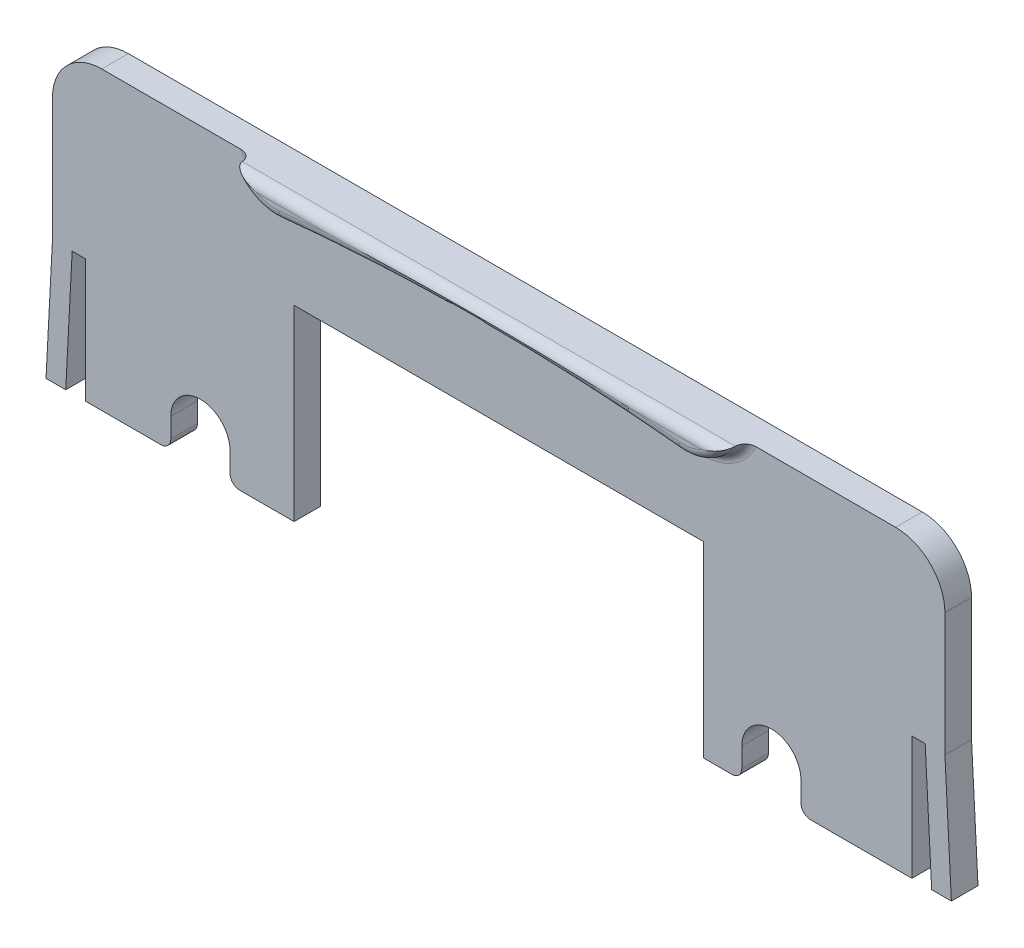
from build123d import *

# Parameters (mm, degrees)
BOSS_EXTRUDE1_DEPTH  = 2.7
FILLET1_R            = 5
BOSS_EXTRUDE2_DEPTH  = 2
FILLET2_R            = 5
FILLET3_R            = 1
FASTENER_HOLES_DEPTH = 52.527686738
FILLET4_R            = 1
WEDGE_DEPTH          = 2.7
CUT_EXTRUDE2_DEPTH   = 53.103914951


with BuildPart() as part:
    # Sketch1 → Boss-Extrude1 (new body)
    with BuildSketch(Plane.XY):
        Polygon((-20.75, -5.5), (20.75, -5.5), (20.75, -24.5), (45.25, -24.5), (45.25, -5.5), (45.25, 5.5), (-45.25, 5.5), (-45.25, -5.5), (-45.25, -24.5), (-20.75, -24.5), align=None)
    extrude(amount=-BOSS_EXTRUDE1_DEPTH)

    # Fillet1
    fillet1_edges = [part.edges().sort_by_distance(p)[0] for p in [
        (-45.25, 5.5, -1.35),
        (45.25, 5.5, -1.35),
    ]]
    fillet(fillet1_edges, radius=FILLET1_R)

    # Sketch2 → Boss-Extrude2 (add)
    with BuildSketch(Plane.XY):
        with BuildLine():
            Line((-25, 5.5), (25, 5.5))
            Line((25, 5.5), (25, 2.5))
            ThreePointArc((25, 2.5), (0, 4.06865167), (-25, 2.5))
            Line((-25, 2.5), (-25, 5.5))
        make_face()
    extrude(amount=BOSS_EXTRUDE2_DEPTH)

    # Fillet2
    # the kernel refuses this fillet: 5 mm, written as the material it takes off along each edge
    with BuildSketch(Plane(origin=(-25, 2.5, 0), x_dir=(0, 1, 0), z_dir=(0, 0, 1))) as fillet2_piece_1:
        with BuildLine():
            CenterArc((5.522601094, -4.316999388), FILLET2_R, 120.299508601, 65.491069006)
            ThreePointArc((0.548114523, -4.821462818), (0.288680447, -2.409069013), (0, 0))
            Line((0, 0), (3, 0))
        make_face()
    extrude(amount=14.131295591, mode=Mode.SUBTRACT)
    with BuildSketch(Plane(origin=(25, 2.5, 0), x_dir=(-0.9936001438850942, 0.11295465493515582, 0), z_dir=(0, 0, 1))) as fillet2_piece_2:
        with BuildLine():
            CenterArc((4.913174714, -4.999632066), FILLET2_R, 90.695089087, 65.491069006)
            Line((0.338863965, -2.980800432), (0, 0))
            ThreePointArc((0, 0), (2.426259118, -0.014717375), (4.852518236, 0))
        make_face()
    extrude(amount=14.131295591, mode=Mode.SUBTRACT)

    # Fillet3
    # the kernel refuses this fillet: 1 mm, written as the material it adds along each edge
    with BuildSketch(Plane(origin=(20.683000612, 8.022601094, 0), x_dir=(-0.10089268591027718, -0.9948973142640452, 0), z_dir=(-0.9948973142640452, 0.10089268591027718, 0))) as fillet3_piece_1_section:
        with BuildLine():
            CenterArc((5 + FILLET3_R, FILLET3_R), FILLET3_R, 180, 90)
            Line((5, FILLET3_R), (5, 0))
            Line((5, 0), (5 + FILLET3_R, 0))
        make_face()
    fillet3_piece_1 = revolve(axis=Axis((20.683000612, 8.022601094, 0), (0, 0, 1)), revolution_arc=94.145051676, mode=Mode.PRIVATE)
    fillet3_piece_1 = split(fillet3_piece_1, bisect_by=Plane(origin=(23.299245225, 5.5, 0.284698162), z_dir=(0, -1, 0)), keep=Keep.TOP, mode=Mode.PRIVATE)
    add(fillet3_piece_1)
    with BuildSketch(Plane(origin=(0, -195.93134833, 0), x_dir=(0.1008926859104223, 0.9948973142640303, 0), z_dir=(0.9948973142640303, -0.1008926859104223, 0))) as fillet3_piece_2:
        with BuildLine():
            CenterArc((200 - FILLET3_R, FILLET3_R), FILLET3_R, 270, 90)
            Line((200, FILLET3_R), (200, 0))
            Line((200, 0), (200 - FILLET3_R, 0))
        make_face()
    revolve(axis=Axis((0, -195.93134833, 0), (0, 0, 1)), revolution_arc=11.581155214)
    with BuildSketch(Plane(origin=(-20.683000612, 8.022601094, 0), x_dir=(-0.999587613586136, -0.028715897429362498, 0), z_dir=(-0.028715897429362498, 0.999587613586136, 0))) as fillet3_piece_3_section:
        with BuildLine():
            CenterArc((5 + FILLET3_R, FILLET3_R), FILLET3_R, 180, 90)
            Line((5, FILLET3_R), (5, 0))
            Line((5, 0), (5 + FILLET3_R, 0))
        make_face()
    fillet3_piece_3 = revolve(axis=Axis((-20.683000612, 8.022601094, 0), (0, 0, 1)), revolution_arc=94.145051676, mode=Mode.PRIVATE)
    fillet3_piece_3 = split(fillet3_piece_3, bisect_by=Plane(origin=(-23.299245227, 5.5, 0.284698166), z_dir=(0, -1, 0)), keep=Keep.TOP, mode=Mode.PRIVATE)
    add(fillet3_piece_3)
    # the kernel refuses this fillet: 1 mm, written as the material it takes off along each edge
    with BuildSketch(Plane(origin=(20.683000612, 8.022601094, 2), x_dir=(0.9995876135861396, -0.028715897429238708, 0), z_dir=(0.028715897429238708, 0.9995876135861396, 0))) as fillet3_2_piece_1:
        with BuildLine():
            CenterArc((5 - FILLET3_R, FILLET3_R), FILLET3_R, 270, 90)
            Line((5, FILLET3_R), (5, 0))
            Line((5, 0), (5 - FILLET3_R, 0))
        make_face()
    revolve(axis=Axis((20.683000612, 8.022601094, 2), (0, 0, -1)), revolution_arc=94.145051676, mode=Mode.SUBTRACT)
    with BuildSketch(Plane(origin=(0, -195.93134833, 2), x_dir=(0.10089268591041367, 0.9948973142640313, 0), z_dir=(0.9948973142640313, -0.10089268591041367, 0))) as fillet3_2_piece_2:
        with BuildLine():
            CenterArc((200 + FILLET3_R, -FILLET3_R), FILLET3_R, 90, 90)
            Line((200, -FILLET3_R), (200, 0))
            Line((200, 0), (200 + FILLET3_R, 0))
        make_face()
    revolve(axis=Axis((0, -195.93134833, 2), (0, 0, 1)), revolution_arc=11.581155214, mode=Mode.SUBTRACT)
    with BuildSketch(Plane(origin=(-20.683000612, 8.022601094, 2), x_dir=(0.10089268591039939, -0.9948973142640327, 0), z_dir=(0.9948973142640327, 0.10089268591039939, 0))) as fillet3_2_piece_3:
        with BuildLine():
            CenterArc((5 - FILLET3_R, FILLET3_R), FILLET3_R, 270, 90)
            Line((5 - FILLET3_R, 0), (5, 0))
            Line((5, 0), (5, FILLET3_R))
        make_face()
    revolve(axis=Axis((-20.683000612, 8.022601094, 2), (0, 0, -1)), revolution_arc=94.145051676, mode=Mode.SUBTRACT)
    with BuildSketch(Plane(origin=(-27.5, 5.5, 2), x_dir=(0, 0, -1), z_dir=(1, 0, 0))) as fillet3_2_piece_4:
        with BuildLine():
            CenterArc((FILLET3_R, -FILLET3_R), FILLET3_R, 90, 90)
            Line((0, -FILLET3_R), (0, 0))
            Line((0, 0), (FILLET3_R, 0))
        make_face()
    extrude(amount=55, mode=Mode.SUBTRACT)

    # Sketch3 → Fastener holes (cut, through all)
    with BuildSketch(Plane.XY):
        with BuildLine():
            Line((-33.25, -24.5), (-33.25, -21.5))
            ThreePointArc((-33.25, -21.5), (-30.25, -18.5), (-27.25, -21.5))
            Line((-27.25, -21.5), (-27.25, -24.5))
            ThreePointArc((-27.25, -24.5), (-30.25, -27.5), (-33.25, -24.5))
        make_face()
        with BuildLine():
            Line((30.65, -24.5), (30.65, -21.5))
            ThreePointArc((30.65, -21.5), (27.65, -18.5), (24.65, -21.5))
            Line((24.65, -21.5), (24.65, -24.5))
            ThreePointArc((24.65, -24.5), (27.65, -27.5), (30.65, -24.5))
        make_face()
    extrude(amount=-FASTENER_HOLES_DEPTH, mode=Mode.SUBTRACT)

    # Fillet4
    fillet4_edges = [part.edges().sort_by_distance(p)[0] for p in [
        (-27.25, -24.5, -1.35),
        (-33.25, -24.5, -1.35),
        (30.65, -24.5, -1.35),
        (24.65, -24.5, -1.35),
    ]]
    fillet(fillet4_edges, radius=FILLET4_R)

    # Sketch4 → Wedge (add)
    with BuildSketch(Plane.XY):
        Polygon((45.25, -12), (45.905097241, -24.5), (45.25, -24.5), align=None)
        Polygon((-45.25, -12), (-45.25, -24.5), (-45.905097241, -24.5), align=None)
    extrude(amount=-WEDGE_DEPTH)

    # Sketch5 → Cut-Extrude2 (cut, through all)
    with BuildSketch(Plane.XY):
        Polygon((43.905097241, -24.5), (43.25, -12), (41.905097241, -12), (41.905097241, -24.5), align=None)
        Polygon((-41.905097241, -24.5), (-43.905097241, -24.5), (-43.25, -12), (-41.905097241, -12), align=None)
    extrude(amount=-CUT_EXTRUDE2_DEPTH, mode=Mode.SUBTRACT)


solid = part.part
